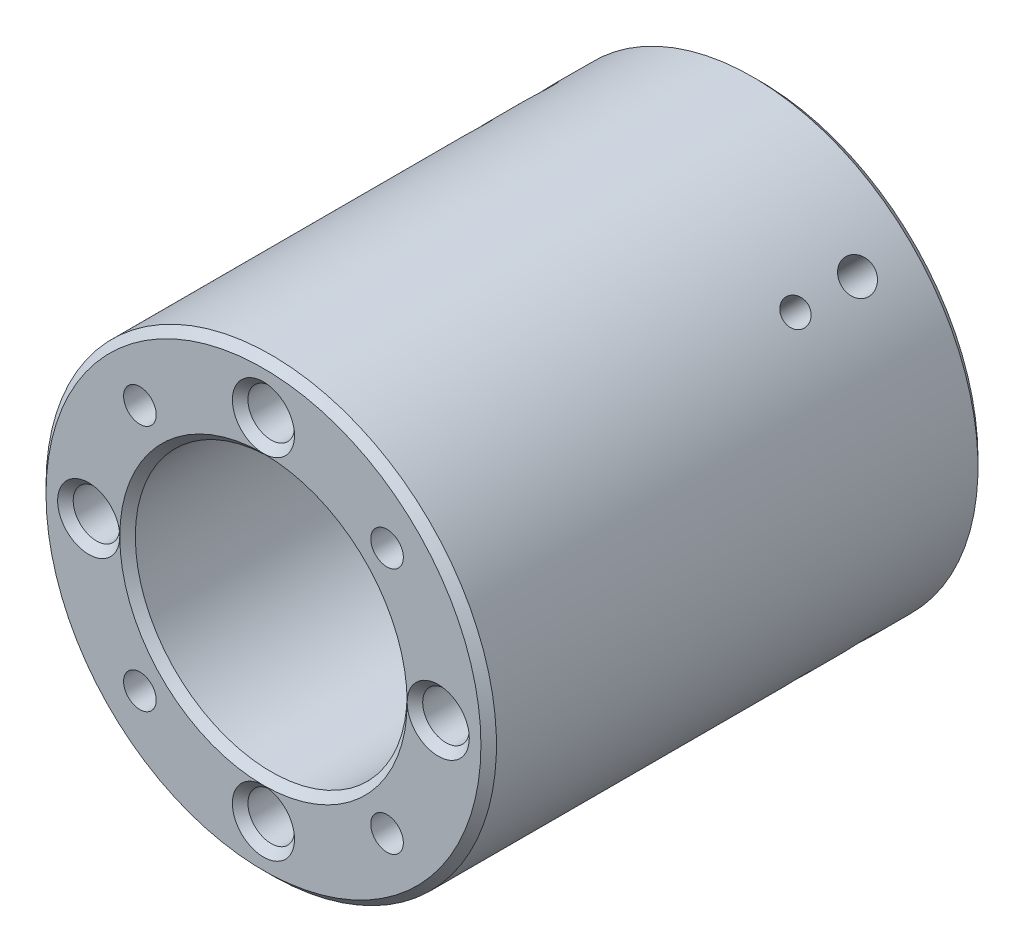
from build123d import *

# Parameters (mm, degrees)
PATTERN_CIRCULAR_1_COUNT = 4
CHAMFER_1_SIZE           = 1
CHAMFER_2_SIZE           = 1
MM_1_D                   = 6
MM_1_DEPTH               = 6
MM_1_TIP                 = 1.802581857
SKETCH_18_W              = 1.65
SKETCH_18_H              = 41.012198951
SKETCH_24_W              = 2.1
SKETCH_24_H              = 41.012198951
PATTERN_CIRCULAR_2_COUNT = 4
CHAMFER_3_SIZE           = 1


with BuildPart() as part:
    # 草图1 → 旋转1 (revolve)
    with BuildSketch(Plane(origin=(0, 0, 0), x_dir=(0, 0, -1), z_dir=(1, 0, 0)), mode=Mode.PRIVATE) as revolve_1_sk:
        Polygon((64, 29), (64, 10), (40, 10), (40, 17.5), (0, 17.5), (0, 29), align=None)
    revolve(revolve_1_sk.sketch.rotate(Axis((0, 0, 74.600938967), (0, 0, -1)), 90), axis=Axis((0, 0, 74.600938967), (0, 0, -1)))

    # 草图5 → M5 螺纹孔1 (revolve, cut)
    with BuildSketch(Plane(origin=(15.909902577, 15.909902577, 0), x_dir=(0, -1, 0), z_dir=(1, 0, 0))):
        Polygon((0, 0), (0, 15.2618073), (2.1, 14), (2.1, 0), align=None)
    hole_wizard_m5_1 = revolve(axis=Axis((15.909902577, 15.909902577, 6.35), (0, 0, -1)), mode=Mode.SUBTRACT)

    # 阵列(圆周)1: M5 螺纹孔1 ×4 about axis
    pattern_circular_1_axis = Axis((0, 0, 0), (0, 0, 1))
    for i in range(1, PATTERN_CIRCULAR_1_COUNT):
        add(hole_wizard_m5_1.rotate(pattern_circular_1_axis, i * 360 / PATTERN_CIRCULAR_1_COUNT), mode=Mode.SUBTRACT)

    # 倒角1
    chamfer_1_edges = [part.edges().sort_by_distance(p)[0] for p in [
        (-29, 0, 0),
        (-29, 0, -64),
    ]]
    chamfer(chamfer_1_edges, length=CHAMFER_1_SIZE)

    # 倒角2
    chamfer_2_edges = [part.edges().sort_by_distance(p)[0] for p in [
        (-10, 0, -64),
        (-10, 0, -40),
        (-17.5, 0, 0),
    ]]
    chamfer(chamfer_2_edges, length=CHAMFER_2_SIZE)

    # 大小mm 暗销孔1
    with Locations(Plane.XY):
        with Locations((0, -22.5), (-22.5, 0), (0, 22.5), (22.5, 0)):
            Hole(MM_1_D / 2, depth=MM_1_DEPTH)
            with Locations((0, 0, -(MM_1_DEPTH + MM_1_TIP / 2))):  # 118° drill point
                Cone(0, MM_1_D / 2, MM_1_TIP, mode=Mode.SUBTRACT)

    # 草图18 → M4 螺纹孔1 (revolve, cut)
    with BuildSketch(Plane(origin=(-2.992e-06, 2.992e-06, -48), x_dir=(-0.4082482226009898, -0.4082483243953038, 0.8164965978934386), z_dir=(0.5773503171759193, 0.5773502451964775, 0.5773502451964775))):
        with Locations((0.825, 20.506099476)):
            Rectangle(SKETCH_18_W, SKETCH_18_H)
    hole_wizard_m4_1 = revolve(axis=Axis((-4.490131053, 4.490131053, -47.99999944), (0.7071067811865461, -0.7071067811865434, -8.815645872088268e-08)), mode=Mode.SUBTRACT)

    # 草图24 → M5 螺纹孔3 (revolve, cut)
    with BuildSketch(Plane(origin=(-3.491e-06, 3.491e-06, -56), x_dir=(-0.4082482226009898, -0.4082483243953038, 0.8164965978934386), z_dir=(0.5773503171759193, 0.5773502451964775, 0.5773502451964775))):
        with Locations((1.05, 20.506099476)):
            Rectangle(SKETCH_24_W, SKETCH_24_H)
    hole_wizard_m5_3 = revolve(axis=Axis((-4.490131551, 4.490131551, -55.99999944), (0.7071067811865462, -0.7071067811865435, -8.81564587208827e-08)), mode=Mode.SUBTRACT)

    # 阵列(圆周)2: M4 螺纹孔1, M5 螺纹孔3 ×4 about axis
    pattern_circular_2_axis = Axis((0, 0, -1), (0, 0, -1))
    add([hole_wizard_m4_1.rotate(pattern_circular_2_axis, i * 360 / PATTERN_CIRCULAR_2_COUNT) for i in range(1, PATTERN_CIRCULAR_2_COUNT)], mode=Mode.SUBTRACT)
    add([hole_wizard_m5_3.rotate(pattern_circular_2_axis, i * 360 / PATTERN_CIRCULAR_2_COUNT) for i in range(1, PATTERN_CIRCULAR_2_COUNT)], mode=Mode.SUBTRACT)

    # 倒角3
    chamfer_3_edges = [part.edges().sort_by_distance(p)[0] for p in [
        (25.5, 0, 0),
        (3, 22.5, 0),
        (-19.5, 0, 0),
        (3, -22.5, 0),
    ]]
    chamfer(chamfer_3_edges, length=CHAMFER_3_SIZE - 0.0001)  # a hair under: the kernel refuses the full size


solid = part.part
